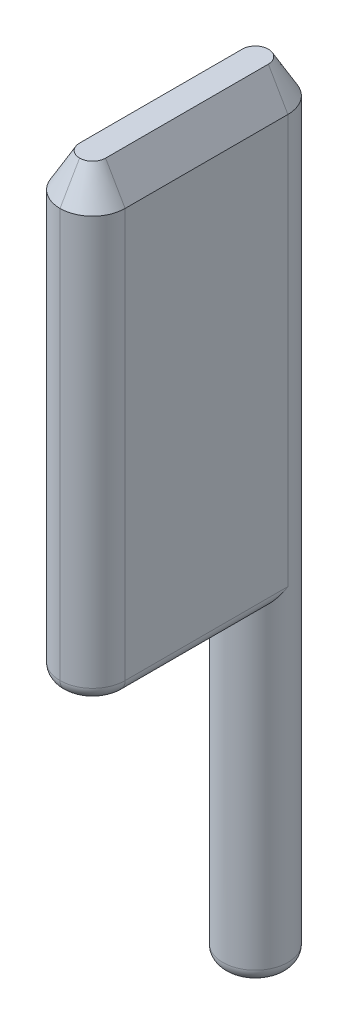
from build123d import *

# Parameters (mm, degrees)
SKETCH1_R           = 5
BOSS_EXTRUDE1_DEPTH = 50
BOSS_EXTRUDE2_DEPTH = 70
FILLET1_R           = 5
FILLET2_R           = 2
FILLET3_R           = 2
CHAMFER1_SIZE       = 3
CHAMFER1_SIZE2      = 5.196152423


# Some blends are built 0.0001 mm under size
with BuildPart() as part:
    # Sketch1 → Boss-Extrude1 (new body)
    with BuildSketch(Plane(origin=(0, 0, 0), x_dir=(1, 0, 0), z_dir=(0, 1, 0))):
        with Locations(Location((0, 0, 0), (0, 0, 270))):
            Circle(SKETCH1_R)
    extrude(amount=BOSS_EXTRUDE1_DEPTH)

    # Sketch2 → Boss-Extrude2 (add)
    with BuildSketch(Plane(origin=(0, 50, 0), x_dir=(1, 0, 0), z_dir=(0, 1, 0))):
        with BuildLine():
            Line((-5, 0), (-5, -30))
            Line((-5, -30), (5, -30))
            Line((5, -30), (5, 0))
            ThreePointArc((5, 0), (0, 5), (-5, 0))
        make_face()
    extrude(amount=BOSS_EXTRUDE2_DEPTH)

    # Fillet1
    fillet1_edges = [part.edges().sort_by_distance(p)[0] for p in [
        (-5, 85, 30),
        (5, 85, 30),
    ]]
    fillet(fillet1_edges, radius=FILLET1_R - 0.0001)  # a hair under: the kernel refuses the full size

    # Fillet2
    # the kernel refuses this fillet: 2 mm, written as the material it takes off along each edge
    with BuildSketch(Plane(origin=(5, 50, 25.0001), x_dir=(-1, 0, 0), z_dir=(0, 0, -1))) as fillet2_piece_1_section:
        with BuildLine():
            CenterArc((FILLET2_R, FILLET2_R), FILLET2_R, 180, 90)
            Line((0, FILLET2_R), (0, 0))
            Line((0, 0), (FILLET2_R, 0))
        make_face()
    fillet2_piece_1 = extrude(amount=30.0001, mode=Mode.PRIVATE)
    fillet2_piece_1 = fillet2_piece_1 - Plane(origin=(0, 50.338854102, 0), x_dir=(0, 0, 1), z_dir=(0, -1, 0)) * Cylinder(5, 69, mode=Mode.PRIVATE)
    add(fillet2_piece_1, mode=Mode.SUBTRACT)
    with BuildSketch(Plane(origin=(0.0001, 50, 25.0001), x_dir=(1, 0, 0), z_dir=(0, 0, -1))) as fillet2_piece_2:
        with BuildLine():
            CenterArc((4.9999 - FILLET2_R, -FILLET2_R), FILLET2_R, 0, 90)
            Line((4.9999, -FILLET2_R), (4.9999, 0))
            Line((4.9999, 0), (4.9999 - FILLET2_R, 0))
        make_face()
    revolve(axis=Axis((0.0001, 50, 25.0001), (0, -1, 0)), revolution_arc=90, mode=Mode.SUBTRACT)
    with BuildSketch(Plane(origin=(-0.0001, 50, 25.0001), x_dir=(0, 0, 1), z_dir=(1, 0, 0))) as fillet2_piece_3:
        with BuildLine():
            CenterArc((4.9999 - FILLET2_R, -FILLET2_R), FILLET2_R, 0, 90)
            Line((4.9999, -FILLET2_R), (4.9999, 0))
            Line((4.9999, 0), (4.9999 - FILLET2_R, 0))
        make_face()
    revolve(axis=Axis((-0.0001, 50, 25.0001), (0, -1, 0)), revolution_arc=90, mode=Mode.SUBTRACT)
    with BuildSketch(Plane(origin=(-5, 50, -5), x_dir=(1, 0, 0), z_dir=(0, 0, 1))) as fillet2_piece_4_section:
        with BuildLine():
            CenterArc((FILLET2_R, FILLET2_R), FILLET2_R, 180, 90)
            Line((0, FILLET2_R), (0, 0))
            Line((0, 0), (FILLET2_R, 0))
        make_face()
    fillet2_piece_4 = extrude(amount=30.0001, mode=Mode.PRIVATE)
    fillet2_piece_4 = fillet2_piece_4 - Plane(origin=(0, 50.465433579, 0), x_dir=(0, 0, 1), z_dir=(0, -1, 0)) * Cylinder(5, 69, mode=Mode.PRIVATE)
    add(fillet2_piece_4, mode=Mode.SUBTRACT)
    with BuildSketch(Plane(origin=(-0.0001, 50, 30), x_dir=(0, 0, -1), z_dir=(1, 0, 0))) as fillet2_piece_5:
        with BuildLine():
            CenterArc((FILLET2_R, FILLET2_R), FILLET2_R, 180, 90)
            Line((0, FILLET2_R), (0, 0))
            Line((0, 0), (FILLET2_R, 0))
        make_face()
    extrude(amount=0.0002, mode=Mode.SUBTRACT)

    # Fillet3
    fillet3_edges = [part.edges().sort_by_distance(p)[0] for p in [
        (0, 0, -5),
    ]]
    fillet(fillet3_edges, radius=FILLET3_R)

    # Chamfer1
    chamfer1_edges = [part.edges().sort_by_distance(p)[0] for p in [
        (5, 120, 12.50005),
        (3.535563195, 120, 28.535563195),
        (-3.535563195, 120, 28.535563195),
        (0, 120, -5),
        (-5, 120, 12.50005),
    ]]
    chamfer1_side = [part.faces().sort_by_distance(p)[0] for p in [
        (0, 120, 12.500020673),
    ]]
    chamfer(chamfer1_edges, length=CHAMFER1_SIZE, length2=CHAMFER1_SIZE2, reference=chamfer1_side[0])


solid = part.part
